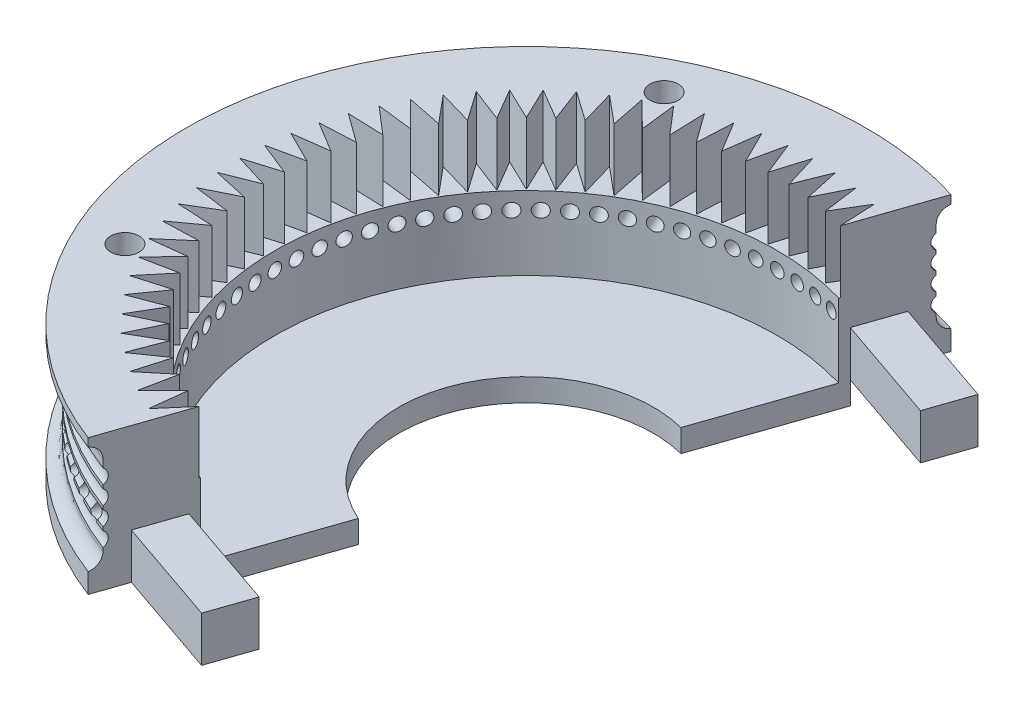
from build123d import *
from build123d.topology import SkipClean

# Parameters (mm, degrees)
SKETCH1_R           = 23
BOSS_EXTRUDE1_DEPTH = 2
SKETCH2_R           = 30
SKETCH2_R_2         = 22.2
BOSS_EXTRUDE2_DEPTH = 12
SKETCH3_R           = 11.25
CUT_EXTRUDE1_DEPTH  = 10
CUT_EXTRUDE8_DEPTH  = 5.5
SKETCH5_R           = 1.25
CUT_EXTRUDE3_DEPTH  = 45.676615807
SKETCH8_R           = 2.5
CUT_EXTRUDE5_DEPTH  = 2
BOSS_EXTRUDE3_DEPTH = 3
CUT_EXTRUDE9_START  = -3
SKETCH13_R          = 3.5
CUT_EXTRUDE9_DEPTH  = 3
CUT_EXTRUDE10_DEPTH = 4
SKETCH17_R          = 0.6
CUT_EXTRUDE12_DEPTH = 33
CIRPATTERN1_COUNT   = 76
CAVITY1_START       = -5
CAVITY1_OUTLINE_R   = 1.25
CAVITY1_OUTLINE_R_2 = 3.5
CAVITY1_DEPTH       = 17
CAVITY1_START_2     = 4
CAVITY1_2_DEPTH     = 8
CAVITY1_START_3     = -2
CAVITY1_3_DEPTH     = 2


# Read off the part's stored shape, not the designer's step: Cavity1
with BuildPart() as part:
    # Sketch1 → Boss-Extrude1 (new body)
    with BuildSketch(Plane(origin=(0, 0, 0), x_dir=(1, 0, 0), z_dir=(0, 1, 0))):
        with Locations(Location((0, 0, 0), (0, 0, 270))):
            Circle(SKETCH1_R)
    extrude(amount=-BOSS_EXTRUDE1_DEPTH)

    # Sketch2 → Boss-Extrude2 (add)
    with BuildSketch(Plane(origin=(0, 0, 0), x_dir=(1, 0, 0), z_dir=(0, 1, 0))):
        with Locations(Location((0, 0, 0), (0, 0, 270))):
            Circle(SKETCH2_R)
        with Locations(Location((0, 0, 0), (0, 0, 270))):
            Circle(SKETCH2_R_2, mode=Mode.SUBTRACT)
    extrude(amount=BOSS_EXTRUDE2_DEPTH)

    # Sketch3 → Cut-Extrude1 (cut)
    with BuildSketch(Plane(origin=(0, 0, 0), x_dir=(1, 0, 0), z_dir=(0, 1, 0))):
        with Locations(Location((0, 0, 0), (0, 0, 270))):
            Circle(SKETCH3_R)
    extrude(amount=-CUT_EXTRUDE1_DEPTH, mode=Mode.SUBTRACT)

    # Sketch10 → Cut-Extrude8 (cut)
    with BuildSketch(Plane(origin=(0, 12, 0), x_dir=(1, 0, 0), z_dir=(0, 1, 0))):
        Polygon((8.200315972, -23.949003355), (8.095646912, -20.796423541), (10.150000757, -23.190028641), (9.785351218, -20.056859988), (12.030350745, -22.272642516), (11.408211652, -19.180287743), (13.828521239, -21.20311166), (12.953142433, -18.172694685), (15.532228911, -19.988742051), (14.409590117, -17.040963696), (17.12983571, -18.637829065), (15.76760569, -15.792825644), (18.610428362, -17.159600809), (17.017912527, -14.43680658), (19.963892917, -15.564155079), (18.151969766, -12.982169489), (21.18098384, -13.862390389), (19.162030646, -11.438851016), (22.253387167, -12.065931515), (20.041195426, -9.817393592), (23.173777294, -10.187050095), (20.78345852, -8.128873414), (23.935867025, -8.238580793), (21.383749518, -6.384824789), (24.534450513, -6.233833631), (21.837967824, -4.597161336), (24.965438827, -4.186503063), (22.143010666, -2.77809461), (25.225887879, -2.110574435), (22.296794293, -0.940050681), (25.314018538, -0.020228443), (22.298268206, 0.904414747), (25.229228782, 2.070255729), (22.147422337, 2.742702106), (24.972097812, 4.146597956), (21.845287117, 4.562254028), (24.544382092, 6.194614714), (21.393926434, 6.350641129), (23.949003355, 8.200315972), (20.796423541, 8.095646912), (23.190028641, 10.150000757), (20.056859988, 9.785351218), (22.272642516, 12.030350745), (19.180287743, 11.408211652), (21.20311166, 13.828521239), (18.172694685, 12.953142433), (19.988742051, 15.532228911), (17.040963696, 14.409590117), (18.637829065, 17.12983571), (15.792825644, 15.76760569), (17.159600809, 18.610428362), (14.43680658, 17.017912527), (15.564155079, 19.963892917), (12.982169489, 18.151969766), (13.862390389, 21.18098384), (11.438851016, 19.162030646), (12.065931515, 22.253387167), (9.817393592, 20.041195426), (10.187050095, 23.173777294), (8.128873414, 20.78345852), (8.238580793, 23.935867025), (6.384824789, 21.383749518), (6.233833631, 24.534450513), (4.597161336, 21.837967824), (4.186503063, 24.965438827), (2.77809461, 22.143010666), (2.110574435, 25.225887879), (0.940050681, 22.296794293), (0.020228443, 25.314018538), (-0.904414747, 22.298268206), (-2.070255729, 25.229228782), (-2.742702106, 22.147422337), (-4.146597956, 24.972097812), (-4.562254028, 21.845287117), (-6.194614714, 24.544382092), (-6.350641129, 21.393926434), (-8.200315972, 23.949003355), (-8.095646912, 20.796423541), (-10.150000757, 23.190028641), (-9.785351218, 20.056859988), (-12.030350745, 22.272642516), (-11.408211652, 19.180287743), (-13.828521239, 21.20311166), (-12.953142433, 18.172694685), (-15.532228911, 19.988742051), (-14.409590117, 17.040963696), (-17.12983571, 18.637829065), (-15.76760569, 15.792825644), (-18.610428362, 17.159600809), (-17.017912527, 14.43680658), (-19.963892917, 15.564155079), (-18.151969766, 12.982169489), (-21.18098384, 13.862390389), (-19.162030646, 11.438851016), (-22.253387167, 12.065931515), (-20.041195426, 9.817393592), (-23.173777294, 10.187050095), (-20.78345852, 8.128873414), (-23.935867025, 8.238580793), (-21.383749518, 6.384824789), (-24.534450513, 6.233833631), (-21.837967824, 4.597161336), (-24.965438827, 4.186503063), (-22.143010666, 2.77809461), (-25.225887879, 2.110574435), (-22.296794293, 0.940050681), (-25.314018538, 0.020228443), (-22.298268206, -0.904414747), (-25.229228782, -2.070255729), (-22.147422337, -2.742702106), (-24.972097812, -4.146597956), (-21.845287117, -4.562254028), (-24.544382092, -6.194614714), (-21.393926434, -6.350641129), (-23.949003355, -8.200315972), (-20.796423541, -8.095646912), (-23.190028641, -10.150000757), (-20.056859988, -9.785351218), (-22.272642516, -12.030350745), (-19.180287743, -11.408211652), (-21.20311166, -13.828521239), (-18.172694685, -12.953142433), (-19.988742051, -15.532228911), (-17.040963696, -14.409590118), (-18.637829065, -17.12983571), (-15.792825644, -15.76760569), (-17.159600809, -18.610428362), (-14.43680658, -17.017912527), (-15.564155079, -19.963892917), (-12.982169489, -18.151969766), (-13.862390389, -21.18098384), (-11.438851016, -19.162030646), (-12.065931515, -22.253387167), (-9.817393592, -20.041195426), (-10.187050095, -23.173777294), (-8.128873414, -20.78345852), (-8.238580793, -23.935867025), (-6.384824789, -21.383749518), (-6.233833631, -24.534450513), (-4.597161336, -21.837967824), (-4.186503063, -24.965438827), (-2.77809461, -22.143010666), (-2.110574435, -25.225887879), (-0.940050681, -22.296794293), (-0.020228443, -25.314018538), (0.904414747, -22.298268206), (2.070255729, -25.229228782), (2.742702106, -22.147422337), (4.146597956, -24.972097812), (4.562254028, -21.845287117), (6.194614714, -24.544382092), (6.350641129, -21.393926434), align=None)
    extrude(amount=-CUT_EXTRUDE8_DEPTH, mode=Mode.SUBTRACT)

    # Sketch5 → Cut-Extrude3 (cut, through all)
    with BuildSketch(Plane(origin=(0, 12, 0), x_dir=(1, 0, 0), z_dir=(0, 1, 0))):
        with Locations(Location((23.816653914, 11.619681422, 0), (0, 0, 270))):
            Circle(SKETCH5_R)
        with Locations(Location((11.619681422, -23.816653914, 0), (0, 0, 270))):
            Circle(SKETCH5_R)
        with Locations(Location((-23.816653914, -11.619681422, 0), (0, 0, 270))):
            Circle(SKETCH5_R)
        with Locations(Location((-11.619681422, 23.816653914, 0), (0, 0, 270))):
            Circle(SKETCH5_R)
    extrude(amount=-CUT_EXTRUDE3_DEPTH, mode=Mode.SUBTRACT)

    # Sketch8 → Cut-Extrude5 (cut)
    with BuildSketch(Plane(origin=(0, 0, 0), x_dir=(-1, 0, 0), z_dir=(0, -1, 0))):
        with Locations(Location((-23.816653914, 11.619681422, 0), (0, 0, 90))):
            Circle(SKETCH8_R)
        with Locations(Location((11.619681422, 23.816653914, 0), (0, 0, 90))):
            Circle(SKETCH8_R)
        with Locations(Location((23.816653914, -11.619681422, 0), (0, 0, 90))):
            Circle(SKETCH8_R)
        with Locations(Location((-11.619681422, -23.816653914, 0), (0, 0, 90))):
            Circle(SKETCH8_R)
    extrude(amount=-CUT_EXTRUDE5_DEPTH, mode=Mode.SUBTRACT)

    # Sketch6 → Cut-Revolve1 (revolve, cut)
    with BuildSketch(Plane(origin=(0, 0, 0), x_dir=(0, 0, -1), z_dir=(1, 0, 0))):
        with BuildLine():
            Line((30.052591235, 11.269978745), (30.611201465, 11.269978745))
            Line((30.611201465, 11.269978745), (30.611201465, 1.744054661))
            Line((30.611201465, 1.744054661), (30.052591235, 1.744054661))
            ThreePointArc((30.052591235, 1.744054661), (29.280418603, 2.14822719), (28.97105922, 2.963029485))
            Line((28.97105922, 2.963029485), (28.97105922, 3.270113549))
            ThreePointArc((28.97105922, 3.270113549), (28.601311894, 3.916571517), (28.97105922, 4.563029485))
            Line((28.97105922, 4.563029485), (28.97105922, 4.870113549))
            ThreePointArc((28.97105922, 4.870113549), (28.601311894, 5.516571517), (28.97105922, 6.163029485))
            Line((28.97105922, 6.163029485), (28.97105922, 6.470113549))
            ThreePointArc((28.97105922, 6.470113549), (28.601311894, 7.116571517), (28.97105922, 7.763029485))
            Line((28.97105922, 7.763029485), (28.97105922, 8.070113549))
            ThreePointArc((28.97105922, 8.070113549), (28.601311894, 8.716571517), (28.97105922, 9.363029485))
            Line((28.97105922, 9.363029485), (28.97105922, 9.670113549))
            Line((28.97105922, 9.670113549), (28.97105922, 10.051003921))
            ThreePointArc((28.97105922, 10.051003921), (29.280418603, 10.865806216), (30.052591235, 11.269978745))
        make_face()
    revolve(axis=Axis((0, -2, 0), (0, 1, 0)), mode=Mode.SUBTRACT)

    # Sketch12 → Boss-Extrude3 (add)
    with BuildSketch(Plane(origin=(0, -2, 0), x_dir=(-1, 0, 0), z_dir=(0, -1, 0))):
        with BuildLine():
            Line((-19.610339715, 3.406145686), (-22.604401204, 3.986816711))
            ThreePointArc((-22.604401204, 3.986816711), (-22.945534904, 0.596732148), (-22.781071358, -2.806501209))
            Line((-22.781071358, -2.806501209), (-13.282801681, -1.913655237))
            Line((-13.282801681, -1.913655237), (-11.151246895, 7.8263568))
            Line((-11.151246895, 7.8263568), (-19.244527438, 12.510068943))
            ThreePointArc((-19.244527438, 12.510068943), (-20.891029647, 9.50886647), (-22.072877276, 6.296169473))
            Line((-22.072877276, 6.296169473), (-19.196569326, 5.50814394))
            ThreePointArc((-19.196569326, 5.50814394), (-12.700037344, 3.137602549), (-19.610339715, 3.406145686))
        make_face()
    extrude(amount=BOSS_EXTRUDE3_DEPTH)

    # Sketch13 → Cut-Extrude9 (cut)
    with SkipClean():  # the faces are left unmerged after this step: merging them gives an invalid solid
        with BuildSketch(Plane(origin=(0, -2, 0), x_dir=(-1, 0, 0), z_dir=(0, -1, 0)).offset(CUT_EXTRUDE9_START)):
            with Locations(Location((-16.134136684, 3.813591988, 0), (0, 0, 270))):
                Circle(SKETCH13_R)
        extrude(amount=CUT_EXTRUDE9_DEPTH, mode=Mode.SUBTRACT)

    # Sketch15 → Cut-Extrude10 (cut)
    with SkipClean():  # the faces are left unmerged after this step: merging them gives an invalid solid
        with BuildSketch(Plane(origin=(0, 0, 0), x_dir=(-1, 0, 0), z_dir=(0, -1, 0))):
            Polygon((-27.685056753, 4.305602049), (-29.062732762, 4.572679608), (-29.895458244, 4.734112549), (-29.095069333, 8.862788139), (-28.130605106, 8.620305944), (-26.766064483, 8.277237952), align=None)
        extrude(amount=-CUT_EXTRUDE10_DEPTH, mode=Mode.SUBTRACT)

    # Sketch17 → Cut-Extrude12 (cut)
    with SkipClean():  # the faces are left unmerged after this step: merging them gives an invalid solid
        with BuildSketch(Plane.XY):
            with Locations(Location((0, 5, 0), (0, 0, 180))):
                Circle(SKETCH17_R)
        cut_extrude12 = extrude(amount=CUT_EXTRUDE12_DEPTH, mode=Mode.SUBTRACT)

    # CirPattern1: Cut-Extrude12 ×76 about axis
    with SkipClean():  # the faces are left unmerged after this step: merging them gives an invalid solid
        cirpattern1_axis = Axis((0, -2, 0), (0, 1, 0))
        for i in range(1, CIRPATTERN1_COUNT):
            add(cut_extrude12.rotate(cirpattern1_axis, i * 360 / CIRPATTERN1_COUNT), mode=Mode.SUBTRACT)

    # Cavity1 outline → Cavity1 (cut)
    with BuildSketch(Plane(origin=(0, 0, 0), x_dir=(1, 0, 0), z_dir=(0, 1, 0)).offset(CAVITY1_START)):
        with BuildLine():
            Line((1.104101441, -24.684738197), (-0.197719232, -28.466968086))
            Line((-0.197719232, -28.466968086), (-9.653293955, -25.212416403))
            Line((-9.653293955, -25.212416403), (-10.631064869, -28.053172009))
            ThreePointArc((-10.631064869, -28.053172009), (18.925554117, -23.277100364), (29.632224761, 4.68308186))
            ThreePointArc((29.632224761, 4.68308186), (29.233371597, 6.738693128), (28.692099243, 8.76147482))
            ThreePointArc((28.692099243, 8.76147482), (21.259592627, 21.166712577), (8.887016243, 28.653463007))
            Line((8.887016243, 28.653463007), (7.90924533, 25.812707401))
            Line((7.90924533, 25.812707401), (17.364820053, 22.558155719))
            Line((17.364820053, 22.558155719), (16.06299938, 18.775925829))
            Line((16.06299938, 18.775925829), (6.607424657, 22.030477512))
            Line((6.607424657, 22.030477512), (2.777023188, 10.901864162))
            ThreePointArc((2.777023188, 10.901864162), (10.637521564, -3.661370643), (-4.521071814, -10.301573164))
            Line((-4.521071814, -10.301573164), (-8.351473282, -21.430186514))
            Line((-8.351473282, -21.430186514), (1.104101441, -24.684738197))
        make_face()
        with Locations((11.619681422, -23.816653914)):
            Circle(CAVITY1_OUTLINE_R, mode=Mode.SUBTRACT)
        with Locations((23.816653914, 11.619681422)):
            Circle(CAVITY1_OUTLINE_R, mode=Mode.SUBTRACT)
        with Locations((16.134136684, 3.813591988)):
            Circle(CAVITY1_OUTLINE_R_2, mode=Mode.SUBTRACT)
    extrude(amount=CAVITY1_DEPTH, mode=Mode.SUBTRACT)

    # Cavity1 2 outline → Cavity1 2 (cut)
    with BuildSketch(Plane(origin=(0, 0, 0), x_dir=(1, 0, 0), z_dir=(0, 1, 0)).offset(CAVITY1_START_2)):
        Polygon((-0.197719232, -28.466968086), (1.104101441, -24.684738197), (-8.351473282, -21.430186514), (-9.653293955, -25.212416403), align=None)
        Polygon((6.607424657, 22.030477512), (16.06299938, 18.775925829), (17.364820053, 22.558155719), (7.90924533, 25.812707401), align=None)
    extrude(amount=CAVITY1_2_DEPTH, mode=Mode.SUBTRACT)

    # Cavity1 3 outline → Cavity1 3 (cut)
    with BuildSketch(Plane(origin=(0, 0, 0), x_dir=(1, 0, 0), z_dir=(0, 1, 0)).offset(CAVITY1_START_3)):
        with BuildLine():
            ThreePointArc((-8.351473282, -21.430186514), (-7.485468872, -21.747821863), (-6.607424661, -22.030477511))
            Line((-6.607424661, -22.030477511), (-8.351473282, -21.430186514))
        make_face()
        with BuildLine():
            Line((6.607424657, 22.030477512), (8.351473281, 21.430186514))
            ThreePointArc((8.351473281, 21.430186514), (7.48546887, 21.747821863), (6.607424657, 22.030477512))
        make_face()
    extrude(amount=CAVITY1_3_DEPTH, mode=Mode.SUBTRACT)


solid = part.part
